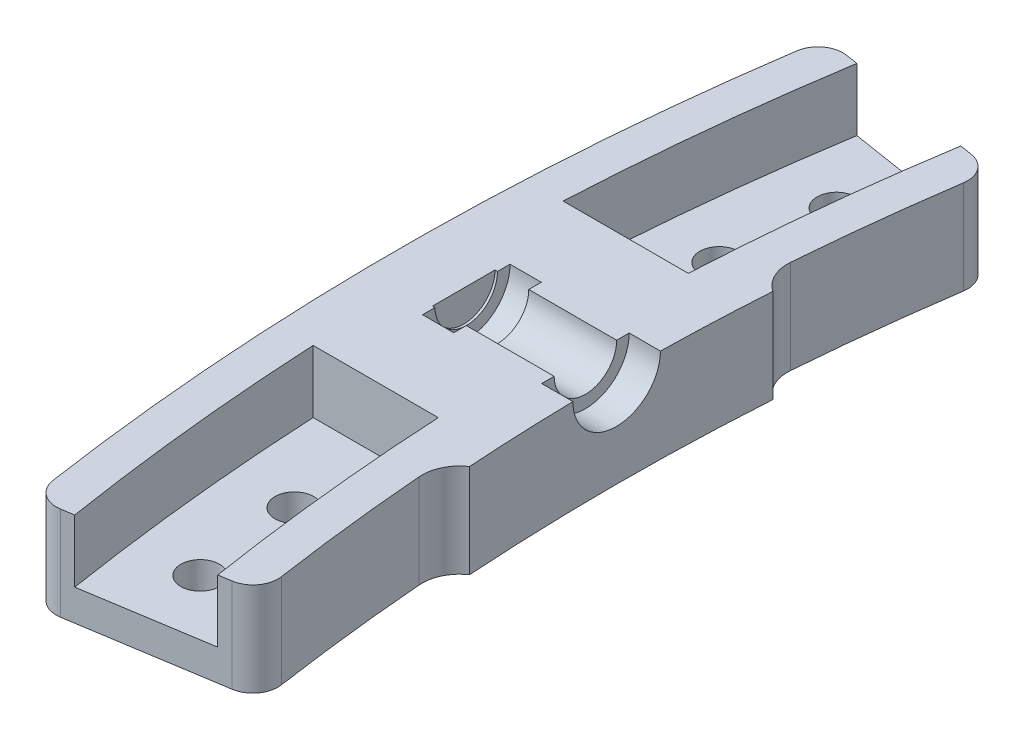
from build123d import *

# Parameters (mm, degrees)
BOSS_EXTRUDE1_DEPTH        = 10
CUT_EXTRUDE1_DEPTH         = 5
F_3_1_3_1_DIAMETER_HOLE2_D = 3.1
BOSS_EXTRUDE2_DEPTH        = 10
FILLET1_R                  = 3
FILLET2_R                  = 2
SKETCH21_R                 = 2.1
CUT_EXTRUDE2_DEPTH         = 36.312840879
SKETCH22_R                 = 3.5
CUT_EXTRUDE3_DEPTH         = 2.5
CUT_EXTRUDE4_DEPTH         = 2.7
CUT_EXTRUDE4_DEPTH_BACK    = 0.2
SKETCH23_R                 = 2.5
SKETCH24_W                 = 2.5
SKETCH24_H                 = 3.5
SKETCH25_R                 = 2.5
CUT_EXTRUDE5_DEPTH         = 9.733021807
CUT_EXTRUDE6_DEPTH         = 2.5


with BuildPart() as part:
    # Sketch1 → Boss-Extrude1 (new body)
    with BuildSketch(Plane(origin=(0, 0, 0), x_dir=(1, 0, 0), z_dir=(0, 1, 0))):
        with BuildLine():
            ThreePointArc((-187.660784713, 29.722548358), (-190, 0), (-187.660784713, -29.722548358))
            Line((-187.660784713, -29.722548358), (-197.537668119, -31.286893008))
            ThreePointArc((-197.537668119, -31.286893008), (-200, 0), (-197.537668119, 31.286893008))
            Line((-197.537668119, 31.286893008), (-187.660784713, 29.722548358))
        make_face()
        with BuildLine():
            ThreePointArc((-197.537668119, -31.286893008), (-200, 0), (-197.537668119, 31.286893008))
            Line((-197.537668119, 31.286893008), (-200.500733141, 31.756196403))
            ThreePointArc((-200.500733141, 31.756196403), (-203, 0), (-200.500733141, -31.756196403))
            Line((-200.500733141, -31.756196403), (-197.537668119, -31.286893008))
        make_face()
        with BuildLine():
            Line((-184.697719691, 29.253244963), (-187.660784713, 29.722548358))
            ThreePointArc((-187.660784713, 29.722548358), (-190, 0), (-187.660784713, -29.722548358))
            Line((-187.660784713, -29.722548358), (-184.697719691, -29.253244963))
            ThreePointArc((-184.697719691, -29.253244963), (-187, 0), (-184.697719691, 29.253244963))
        make_face()
    extrude(amount=BOSS_EXTRUDE1_DEPTH)

    # Sketch15 → Cut-Extrude1 (cut)
    with BuildSketch(Plane(origin=(0, 10, 0), x_dir=(1, 0, 0), z_dir=(0, 1, 0))):
        with BuildLine():
            Line((-199.749843554, 10), (-189.73665961, 10))
            ThreePointArc((-189.73665961, 10), (-188.956218405, 19.88837666), (-187.660784713, 29.722548358))
            Line((-187.660784713, 29.722548358), (-197.537668119, 31.286893008))
            ThreePointArc((-197.537668119, 31.286893008), (-198.928692466, 20.673057674), (-199.749843554, 10))
        make_face()
        with BuildLine():
            ThreePointArc((-187.660784713, -29.722548358), (-188.956218405, -19.88837666), (-189.73665961, -10))
            Line((-189.73665961, -10), (-199.749843554, -10))
            ThreePointArc((-199.749843554, -10), (-198.928692466, -20.673057674), (-197.537668119, -31.286893008))
            Line((-197.537668119, -31.286893008), (-187.660784713, -29.722548358))
        make_face()
    extrude(amount=-CUT_EXTRUDE1_DEPTH, mode=Mode.SUBTRACT)

    # Ø3.1 (3.1) Diameter Hole2 (through all)
    with Locations(Plane(origin=(0, 0, 0), x_dir=(-1, 0, 0), z_dir=(0, -1, 0))):
        with Locations((193.331747968, -25.452607483), (194.257966128, -16.995369836), (194.257966128, 16.995369836), (193.331747968, 25.452607483)):
            Hole(F_3_1_3_1_DIAMETER_HOLE2_D / 2)

    # Sketch19 → Boss-Extrude2 (add)
    with BuildSketch(Plane(origin=(0, 0, 0), x_dir=(1, 0, 0), z_dir=(0, 1, 0))):
        with BuildLine():
            Line((-185.102830261, -12.132280472), (-186.599618646, -12.230385166))
            ThreePointArc((-186.599618646, -12.230385166), (-187, 0), (-186.599618646, 12.230385166))
            Line((-186.599618646, 12.230385166), (-185.102830261, 12.132280472))
            ThreePointArc((-185.102830261, 12.132280472), (-185.5, 0), (-185.102830261, -12.132280472))
        make_face()
    extrude(amount=BOSS_EXTRUDE2_DEPTH)

    # Fillet1
    # the kernel refuses this fillet: 3 mm, written as the material it adds along each edge
    with BuildSketch(Plane(origin=(-186.599618646, 0, -12.230385166), x_dir=(0.07241784502459461, 0, -0.9973743809232287), z_dir=(0, 1, 0))) as fillet1_piece_1:
        with BuildLine():
            CenterArc((2.608644701, -2.999925838), FILLET1_R, 89.597127862, 60.403689883)
            Line((0.010547081, -1.499962919), (-0.041414871, -1.469963661))
            ThreePointArc((-0.041414871, -1.469963661), (-0.054724976, -0.750403343), (-0.059998517, -0.000421883))
            Line((-0.059998517, -0.000421883), (-0.000421883, 0.059998517))
            ThreePointArc((-0.000421883, 0.059998517), (1.314869431, 0.064622735), (2.630160746, 0.059998517))
            Line((2.630160746, 0.059998517), (2.629738863, 0))
        make_face()
    extrude(amount=10)
    with BuildSketch(Plane(origin=(-186.599618646, 0, 12.230385166), x_dir=(0.0724178450245846, 0, 0.9973743809232295), z_dir=(0, 1, 0))) as fillet1_piece_2:
        with BuildLine():
            CenterArc((2.608644701, 2.999925838), FILLET1_R, 209.999182255, 60.403689883)
            Line((0.010547081, 1.499962919), (-0.041414871, 1.469963661))
            ThreePointArc((-0.041414871, 1.469963661), (-0.054724976, 0.750403343), (-0.059998517, 0.000421883))
            Line((-0.059998517, 0.000421883), (-0.000421883, -0.059998517))
            ThreePointArc((-0.000421883, -0.059998517), (1.314869431, -0.064622735), (2.630160746, -0.059998517))
            Line((2.630160746, -0.059998517), (2.629738863, 0))
        make_face()
    extrude(amount=10)

    # Fillet2
    fillet2_edges = [part.edges().sort_by_distance(p)[0] for p in [
        (-200.500733141, 5, 31.756196403),
        (-200.500733141, 5, -31.756196403),
        (-184.697719691, 5, -29.253244963),
        (-184.697719691, 5, 29.253244963),
    ]]
    fillet(fillet2_edges, radius=FILLET2_R)

    # Sketch21 → Cut-Extrude2 (cut, through all)
    with BuildSketch(Plane(origin=(-197.5, 0, 0), x_dir=(0, 0, -1), z_dir=(1, 0, 0))):
        with Locations((0, 10)):
            Circle(SKETCH21_R)
    extrude(amount=CUT_EXTRUDE2_DEPTH, mode=Mode.SUBTRACT)

    # Sketch22 → Cut-Extrude3 (cut)
    with BuildSketch(Plane(origin=(-197.5, 0, 0), x_dir=(0, 0, -1), z_dir=(1, 0, 0))):
        with Locations((0, 10)):
            Circle(SKETCH22_R)
    extrude(amount=CUT_EXTRUDE3_DEPTH, mode=Mode.SUBTRACT)

    # Sketch23 → Cut-Extrude4 (cut, two sides: drawn at the far end of the back side and taken through both)
    with BuildSketch(Plane(origin=(-197.5, 0, 0), x_dir=(0, 0, -1), z_dir=(1, 0, 0)).offset(-CUT_EXTRUDE4_DEPTH_BACK)):
        with Locations((0, 10)):
            Circle(SKETCH23_R)
    extrude(amount=CUT_EXTRUDE4_DEPTH + CUT_EXTRUDE4_DEPTH_BACK, mode=Mode.SUBTRACT)

    # Sketch24 → Cut-Revolve1 (revolve, cut)
    with BuildSketch(Plane(origin=(0, 10, 0), x_dir=(1, 0, 0), z_dir=(0, 1, 0))):
        with Locations((-186.716978193, 1.75)):
            Rectangle(SKETCH24_W, SKETCH24_H)
    revolve(axis=Axis((-185.5, 10, 0), (-1, 0, 0)), mode=Mode.SUBTRACT)

    # Sketch25 → Cut-Extrude5 (cut)
    with BuildSketch(Plane(origin=(-187.966978193, 0, 0), x_dir=(0, 0, -1), z_dir=(1, 0, 0))):
        with Locations((0, 10)):
            Circle(SKETCH25_R)
    extrude(amount=-CUT_EXTRUDE5_DEPTH, mode=Mode.SUBTRACT)

    # Sketch26 → Cut-Extrude6 (cut)
    with BuildSketch(Plane.XZ):
        with BuildLine():
            Line((-198.515528472, -31.441770873), (-186.662644351, -29.564458455))
            ThreePointArc((-186.662644351, -29.564458455), (-185.363721979, -28.773196969), (-184.996936421, -27.297133819))
            ThreePointArc((-184.996936421, -27.297133819), (-185.807261228, -21.087002508), (-186.409178624, -14.853219336))
            ThreePointArc((-186.409178624, -14.853219336), (-186.123110766, -13.316498702), (-185.102830261, -12.132280472))
            ThreePointArc((-185.102830261, -12.132280472), (-185.5, 0), (-185.102830261, 12.132280472))
            ThreePointArc((-185.102830261, 12.132280472), (-186.123110766, 13.316498702), (-186.409178624, 14.853219336))
            ThreePointArc((-186.409178624, 14.853219336), (-185.807261228, 21.087002508), (-184.996936421, 27.297133819))
            ThreePointArc((-184.996936421, 27.297133819), (-185.363721979, 28.773196969), (-186.662644351, 29.564458455))
            Line((-186.662644351, 29.564458455), (-198.515528472, 31.441770873))
            ThreePointArc((-198.515528472, 31.441770873), (-200.012003377, 31.078559473), (-200.806789416, 29.759592144))
            ThreePointArc((-200.806789416, 29.759592144), (-203, 0), (-200.806789416, -29.759592144))
            ThreePointArc((-200.806789416, -29.759592144), (-200.012003377, -31.078559473), (-198.515528472, -31.441770873))
        make_face()
    extrude(amount=-CUT_EXTRUDE6_DEPTH, mode=Mode.SUBTRACT)


solid = part.part
